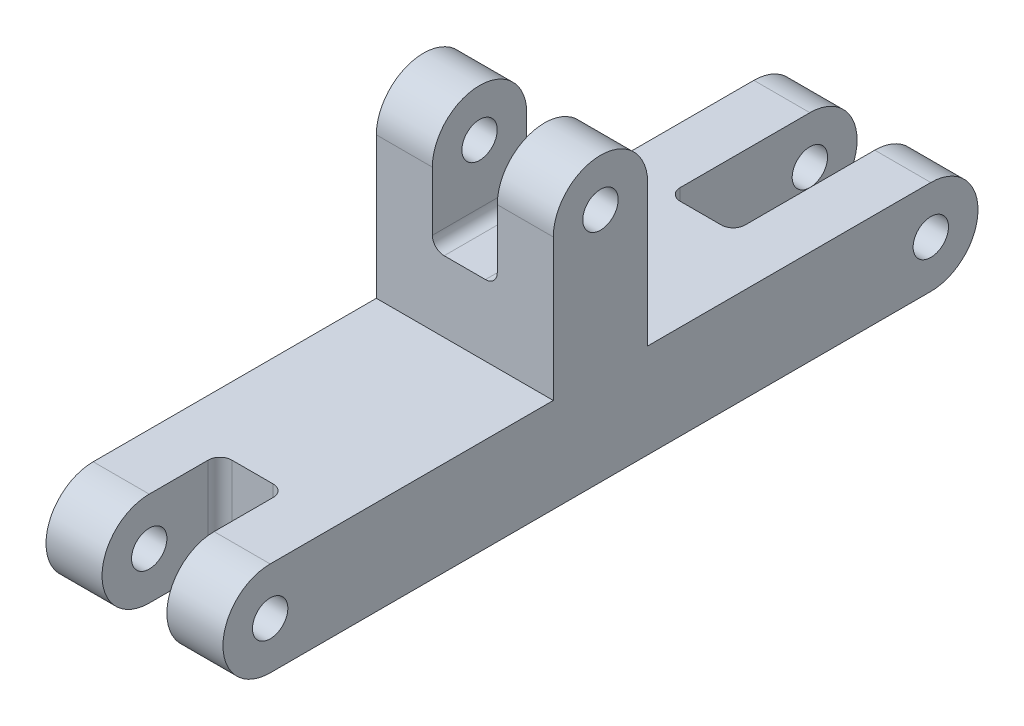
from build123d import *

# Parameters (mm, degrees)
CROQUIS1_R              = 1.5
SALIENTE_EXTRUIR1_DEPTH = 7.5
CROQUIS2_W              = 8
CROQUIS2_H              = 10
CROQUIS2_W_2            = 16
CROQUIS2_H_2            = 8
CROQUIS2_W_3            = 10
CORTAR_EXTRUIR1_DEPTH   = 2.75
REDONDEO1_R             = 1


with BuildPart() as part:
    # Croquis1 → Saliente-Extruir1 (new, symmetric)
    with BuildSketch(Plane(origin=(0, 0, 0), x_dir=(0, 0, -1), z_dir=(1, 0, 0))):
        with BuildLine():
            Line((-15, -4), (15, -4))
            ThreePointArc((15, -4), (19, 0), (15, 4))
            Line((15, 4), (-9, 4))
            Line((-9, 4), (-9, 16))
            ThreePointArc((-9, 16), (-13, 20), (-17, 16))
            Line((-17, 16), (-17, 4))
            Line((-17, 4), (-41, 4))
            ThreePointArc((-41, 4), (-45, 0), (-41, -4))
            Line((-41, -4), (-15, -4))
        make_face()
        with Locations((15, 0)):
            Circle(CROQUIS1_R, mode=Mode.SUBTRACT)
        with Locations((-13, 16)):
            Circle(CROQUIS1_R, mode=Mode.SUBTRACT)
        with Locations((-41, 0)):
            Circle(CROQUIS1_R, mode=Mode.SUBTRACT)
    extrude(amount=SALIENTE_EXTRUIR1_DEPTH, both=True)

    # Croquis2 → Cortar-Extruir1 (cut, symmetric)
    with BuildSketch(Plane(origin=(0, 0, 0), x_dir=(0, 0, -1), z_dir=(1, 0, 0))):
        with Locations((-13, 15)):
            Rectangle(CROQUIS2_W, CROQUIS2_H)
        with Locations((11, 0)):
            Rectangle(CROQUIS2_W_2, CROQUIS2_H_2)
        with Locations((-40, 0)):
            Rectangle(CROQUIS2_W_3, CROQUIS2_H_2)
    extrude(amount=CORTAR_EXTRUIR1_DEPTH, both=True, mode=Mode.SUBTRACT)

    # Redondeo1
    redondeo1_edges = [part.edges().sort_by_distance(p)[0] for p in [
        (2.75, 0, 35),
        (-2.75, 0, 35),
        (2.75, 0, -3),
        (-2.75, 0, -3),
        (2.75, 10, 13),
        (-2.75, 10, 13),
    ]]
    fillet(redondeo1_edges, radius=REDONDEO1_R)


solid = part.part
